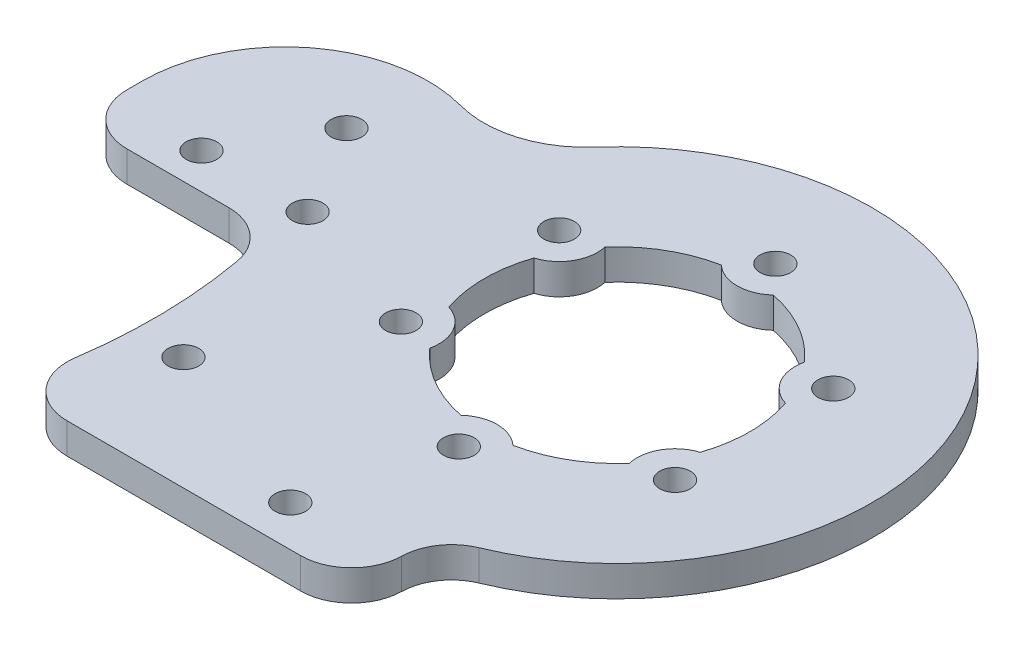
from build123d import *

# Parameters (mm, degrees)
SKETCH_1_R      = 1.5
EXTRUDE_1_DEPTH = 3
FILLET_1_R      = 5
FILLET_2_R      = 10
FILLET_6_R      = 5
FILLET_7_R      = 5


with BuildPart() as part:
    # 草图1 → 凸台-拉伸1 (new body)
    with BuildSketch(Plane(origin=(0, 0, 0), x_dir=(1, 0, 0), z_dir=(0, 1, 0))):
        with BuildLine():
            Line((-46.499999325, -0.004997817), (-46.499999325, -6.504997817))
            Line((-46.499999325, -6.504997817), (-27.499999325, -6.504997817))
            ThreePointArc((-27.499999325, -6.504997817), (-25.781102931, -19.502498908), (-27.499999325, -32.5))
            Line((-27.499999325, -32.5), (6.5, -32.5))
            Line((6.5, -32.5), (6.5, -24.140215409))
            ThreePointArc((6.5, -24.140215409), (18.98987541, 16.25990873), (-22.851559401, 10.139340853))
            ThreePointArc((-22.851559401, 10.139340853), (-38.019140611, 12.86120129), (-46.499999325, -0.004997817))
        make_face()
        with Locations((-32.499999325, 5.995002183)):
            Circle(SKETCH_1_R, mode=Mode.SUBTRACT)
        with Locations((-27.303846902, -3.004997817)):
            Circle(SKETCH_1_R, mode=Mode.SUBTRACT)
        with Locations((-3.5, -28.5)):
            Circle(SKETCH_1_R, mode=Mode.SUBTRACT)
        with Locations((-37.696151748, -3.004997817)):
            Circle(SKETCH_1_R, mode=Mode.SUBTRACT)
        with Locations((-21.058777701, -21.409353158)):
            Circle(SKETCH_1_R, mode=Mode.SUBTRACT)
        with Locations((0, 15.5)):
            Circle(SKETCH_1_R, mode=Mode.SUBTRACT)
        with Locations((13.423393759, 7.75)):
            Circle(SKETCH_1_R, mode=Mode.SUBTRACT)
        with Locations((13.423393759, -7.75)):
            Circle(SKETCH_1_R, mode=Mode.SUBTRACT)
        with Locations((0, -15.5)):
            Circle(SKETCH_1_R, mode=Mode.SUBTRACT)
        with Locations((-13.423393759, -7.75)):
            Circle(SKETCH_1_R, mode=Mode.SUBTRACT)
        with Locations((-13.423393759, 7.75)):
            Circle(SKETCH_1_R, mode=Mode.SUBTRACT)
        with BuildLine():
            ThreePointArc((-12.313744557, 4.167936537), (-13, 0), (-12.313744557, -4.167936537))
            ThreePointArc((-12.313744557, -4.167936537), (-10.175798494, -5.875), (-9.766411201, -8.580047334))
            ThreePointArc((-9.766411201, -8.580047334), (-6.5, -11.258330249), (-2.547333356, -12.747983871))
            ThreePointArc((-2.547333356, -12.747983871), (0, -11.75), (2.547333356, -12.747983871))
            ThreePointArc((2.547333356, -12.747983871), (6.5, -11.258330249), (9.766411201, -8.580047334))
            ThreePointArc((9.766411201, -8.580047334), (10.175798494, -5.875), (12.313744557, -4.167936537))
            ThreePointArc((12.313744557, -4.167936537), (13, 0), (12.313744557, 4.167936537))
            ThreePointArc((12.313744557, 4.167936537), (10.175798494, 5.875), (9.766411201, 8.580047334))
            ThreePointArc((9.766411201, 8.580047334), (6.5, 11.258330249), (2.547333356, 12.747983871))
            ThreePointArc((2.547333356, 12.747983871), (0, 11.75), (-2.547333356, 12.747983871))
            ThreePointArc((-2.547333356, 12.747983871), (-6.5, 11.258330249), (-9.766411201, 8.580047334))
            ThreePointArc((-9.766411201, 8.580047334), (-10.175798494, 5.875), (-12.313744557, 4.167936537))
        make_face(mode=Mode.SUBTRACT)
    extrude(amount=EXTRUDE_1_DEPTH)

    # 圆角1
    fillet_1_edges = [part.edges().sort_by_distance(p)[0] for p in [
        (-46.499999325, 1.5, 6.504997817),
        (-27.499999325, 1.5, 32.5),
        (-27.499999325, 1.5, 6.504997817),
    ]]
    fillet(fillet_1_edges, radius=FILLET_1_R)

    # 圆角2
    fillet_2_edges = [part.edges().sort_by_distance(p)[0] for p in [
        (-22.851559401, 1.5, -10.139340853),
    ]]
    fillet(fillet_2_edges, radius=FILLET_2_R)

    # 圆角6
    fillet_6_edges = [part.edges().sort_by_distance(p)[0] for p in [
        (6.5, 1.5, 24.140215409),
    ]]
    fillet(fillet_6_edges, radius=FILLET_6_R)

    # 圆角7
    fillet_7_edges = [part.edges().sort_by_distance(p)[0] for p in [
        (6.5, 1.5, 32.5),
    ]]
    fillet(fillet_7_edges, radius=FILLET_7_R)


solid = part.part
